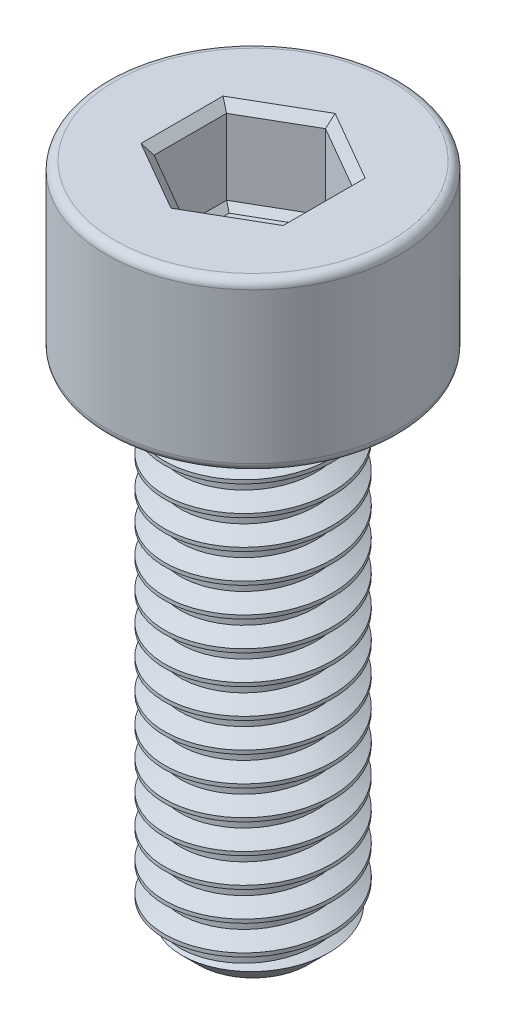
from build123d import *

# Parameters (mm, degrees)
SKETCH1_R           = 2
BOSS_EXTRUDE1_DEPTH = 12
THREAD1_PITCH       = 0.7
SKETCH4_R           = 3.5
BOSS_EXTRUDE2_DEPTH = 4
FILLET1_R           = 0.2
CUT_EXTRUDE1_DEPTH  = 2
CHAMFER1_SIZE       = 0.2
CUT_EXTRUDE2_DEPTH  = 0.15
CUT_EXTRUDE2_DRAFT  = -45


with BuildPart() as part:
    # Sketch1 → Boss-Extrude1 (new body)
    with BuildSketch(Plane(origin=(0, 0, 0), x_dir=(1, 0, 0), z_dir=(0, 1, 0))):
        with Locations(Location((0, 0, 0), (0, 0, 270))):
            Circle(SKETCH1_R)
    extrude(amount=BOSS_EXTRUDE1_DEPTH)

    # Thread1: arcs per turn and ends read off the stored shape
    # Thread1: the profile of Thread Profile1 profile screwed along a right-hand helix through 20 turns, 6 arcs to a turn; built about Z, then put on its axis
    thread1_z = Axis((0, 0, 0), (0, 0, 1))
    thread1_corners = [(2.0003, 0, -0.000173205), (2.0003, 0, 0.612673203), (1.621113887, 0, 0.393749999), (1.621113887, 0, 0.218749999)]
    with BuildLine(mode=Mode.PRIVATE) as thread1_profile:
        Line(thread1_corners[0], thread1_corners[1])
        Line(thread1_corners[1], thread1_corners[2])
        Line(thread1_corners[2], thread1_corners[3])
        Line(thread1_corners[3], thread1_corners[0])
    thread1_cap = Face(thread1_profile.wire())
    thread1_turn_angles = [0, 30, 60, 90, 120, 150, 180, 210, 240, 270, 300, 330, 360]
    thread1_turn_weights = [1, 0.8660254037844387, 1, 0.8660254037844387, 1, 0.8660254037844387, 1, 0.8660254037844387, 1, 0.8660254037844387, 1, 0.8660254037844387, 1]
    thread1_turn_rails = [Edge.make_bspline([Vector(p[0], p[1], 0).rotate(thread1_z, thread1_turn_angles[k]) / thread1_turn_weights[k] + Vector(0, 0, p[2] + THREAD1_PITCH * thread1_turn_angles[k] / 360) for k in range(13)], [0, 0, 0, 1, 1, 2, 2, 3, 3, 4, 4, 5, 5, 6, 6, 6], 2, thread1_turn_weights) for p in thread1_corners]
    thread1_turn_sides = [Face.make_surface_from_curves(thread1_turn_rails[p[0]], thread1_turn_rails[p[1]]) for p in [(0, 1), (1, 2), (2, 3), (3, 0)]]
    thread1 = Plane(origin=(0, -1, 0), x_dir=(1, 0, 0), z_dir=(0, 1, 0)) * Solid(Shell([*[p.moved(Location((0, 0, THREAD1_PITCH * i))) for i in range(20) for p in thread1_turn_sides], thread1_cap, thread1_cap.rotate(thread1_z, 7200).moved(Location((0, 0, THREAD1_PITCH * 7200 / 360)))]))
    add(thread1, mode=Mode.SUBTRACT)

    # Sketch4 → Boss-Extrude2 (add)
    with BuildSketch(Plane(origin=(0, 12, 0), x_dir=(-1, 0, 0), z_dir=(0, -1, 0))):
        with Locations(Location((0, 0, 0), (0, 0, 90))):
            Circle(SKETCH4_R)
    extrude(amount=-BOSS_EXTRUDE2_DEPTH)

    # Fillet1
    fillet1_edges = [part.edges().sort_by_distance(p)[0] for p in [
        (0, 12, 3.5),
        (0, 16, 3.5),
    ]]
    fillet(fillet1_edges, radius=FILLET1_R)

    # Sketch6 → Cut-Revolve1 (revolve, cut)
    with BuildSketch(Plane.XY, mode=Mode.PRIVATE) as cut_revolve1_sk:
        Polygon((2.01, 0), (2.01, 0.7), (1.31, 0), align=None)
    revolve(cut_revolve1_sk.sketch.rotate(Axis((0, 0, 0), (0, 1, 0)), 202.132599438), axis=Axis((0, 0, 0), (0, 1, 0)), mode=Mode.SUBTRACT)

    # Sketch7 → Cut-Extrude1 (cut)
    with BuildSketch(Plane(origin=(0, 16, 0), x_dir=(1, 0, 0), z_dir=(0, 1, 0))):
        Polygon((0, 1.732050808), (-1.5, 0.866025404), (-1.5, -0.866025404), (0, -1.732050808), (1.5, -0.866025404), (1.5, 0.866025404), align=None)
    extrude(amount=-CUT_EXTRUDE1_DEPTH, mode=Mode.SUBTRACT)

    # Chamfer1
    chamfer1_edges = [part.edges().sort_by_distance(p)[0] for p in [
        (0.75, 16, -1.299038106),
        (-0.75, 16, -1.299038106),
        (-1.5, 16, 0),
        (-0.75, 16, 1.299038106),
        (0.75, 16, 1.299038106),
        (1.5, 16, 0),
    ]]
    chamfer(chamfer1_edges, length=CHAMFER1_SIZE)


with BuildPart() as cut_extrude2_tool:
    # Sketch8 → Cut-Extrude2 (with draft: the straight prism first)
    with BuildSketch(Plane(origin=(0, 14, 0), x_dir=(1, 0, 0), z_dir=(0, 1, 0))):
        Polygon((0, 1.732050808), (-1.5, 0.866025404), (-1.5, -0.866025404), (0, -1.732050808), (1.5, -0.866025404), (1.5, 0.866025404), align=None)
    extrude(amount=-CUT_EXTRUDE2_DEPTH)
    # Cut-Extrude2: the draft: its side faces are tilted about the plane it starts from
    cut_extrude2_sides = [cut_extrude2_tool.faces().sort_by_distance(p)[0] for p in [
        (-0.75, 13.925, -1.299038106),
        (-1.5, 13.925, 0),
        (-0.75, 13.925, 1.299038106),
        (0.75, 13.925, 1.299038106),
        (1.5, 13.925, 0),
        (0.75, 13.925, -1.299038106),
    ]]
    draft(cut_extrude2_sides, Plane(origin=(0, 14, 0), x_dir=(1, 0, 0), z_dir=(0, 1, 0)), CUT_EXTRUDE2_DRAFT)


with BuildPart() as part_1:
    add(part.part)

    # Cut-Extrude2: cut by cut_extrude2_tool
    add(cut_extrude2_tool.part, mode=Mode.SUBTRACT)


solid = part_1.part
